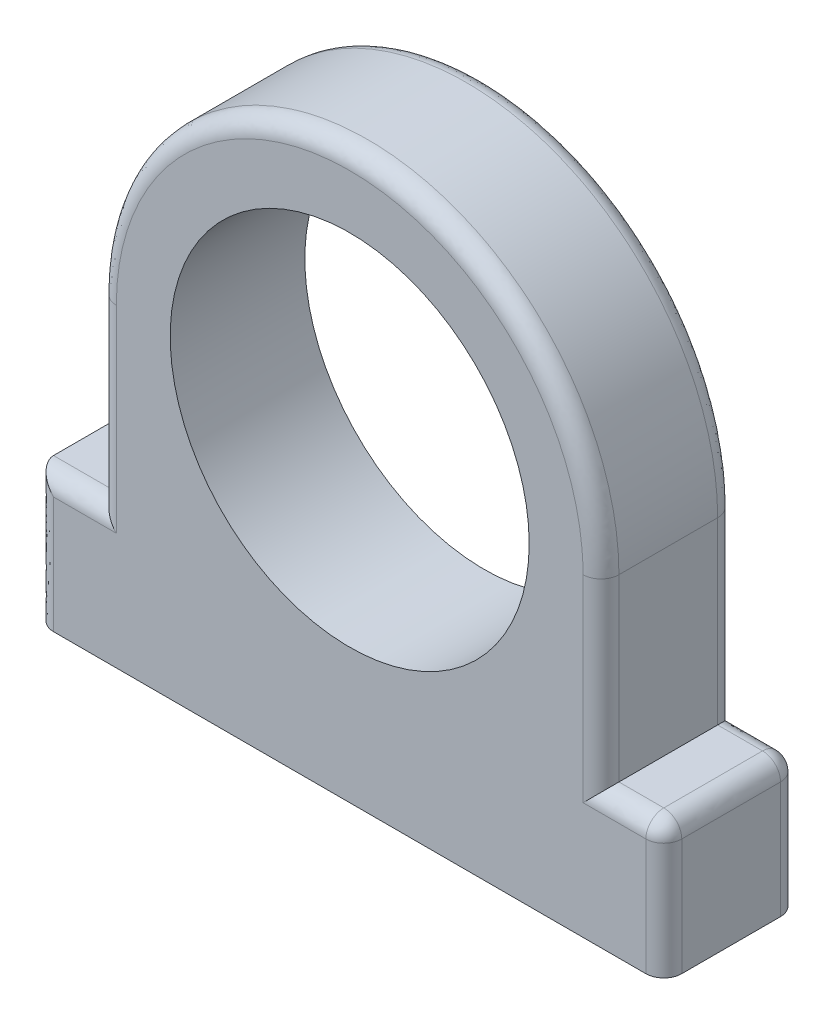
from build123d import *

# Parameters (mm, degrees)
SKETCH1_R           = 20
BOSS_EXTRUDE1_DEPTH = 15
FILLET1_R           = 2


with BuildPart() as part:
    # Sketch1 → Boss-Extrude1 (new body)
    with BuildSketch(Plane.XY):
        with BuildLine():
            Line((-23.745690135, -15), (46.254309865, -15))
            Line((46.254309865, -15), (46.254309865, 0))
            Line((46.254309865, 0), (39.254309865, 0))
            Line((39.254309865, 0), (39.254309865, 20))
            ThreePointArc((39.254309865, 20), (11.254309865, 48), (-16.745690135, 20))
            Line((-16.745690135, 20), (-16.745690135, 0))
            Line((-16.745690135, 0), (-23.745690135, 0))
            Line((-23.745690135, 0), (-23.745690135, -15))
        make_face()
        with Locations((11.254309865, 20)):
            Circle(SKETCH1_R, mode=Mode.SUBTRACT)
    extrude(amount=BOSS_EXTRUDE1_DEPTH)

    # Fillet1
    fillet1_edges = [part.edges().sort_by_distance(p)[0] for p in [
        (46.254309865, -7.5, 15),
        (46.254309865, -7.5, 0),
        (46.254309865, 0, 7.5),
        (42.754309865, 0, 0),
        (-20.245690135, 0, 0),
        (-23.745690135, -7.5, 0),
        (39.254309865, 10, 0),
        (-16.745690135, 10, 0),
        (11.254309865, 48, 0),
        (-23.745690135, -7.5, 15),
        (-20.245690135, 0, 15),
        (42.754309865, 0, 15),
        (39.254309865, 10, 15),
        (-16.745690135, 10, 15),
        (11.254309865, 48, 15),
    ]]
    fillet(fillet1_edges, radius=FILLET1_R)


solid = part.part
